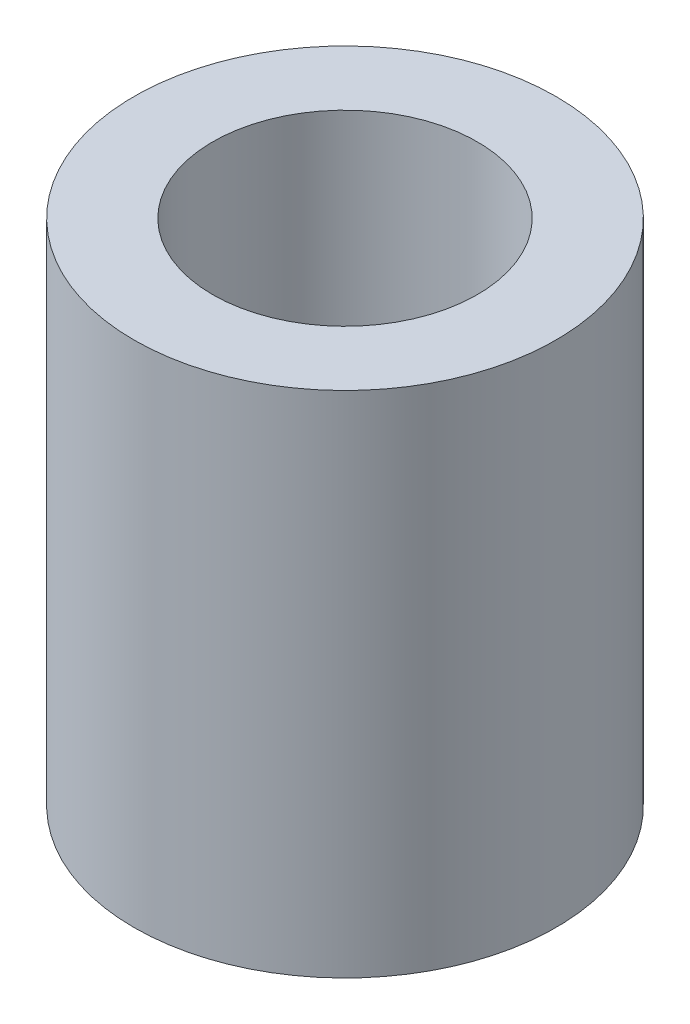
from build123d import *

# Parameters (mm, degrees)
SKETCH1_R           = 2.55
SKETCH1_R_2         = 1.6
BOSS_EXTRUDE1_DEPTH = 6.15


with BuildPart() as part:
    # Sketch1 → Boss-Extrude1 (new body)
    with BuildSketch(Plane(origin=(0, 0, 0), x_dir=(1, 0, 0), z_dir=(0, 1, 0))):
        Circle(SKETCH1_R)
        Circle(SKETCH1_R_2, mode=Mode.SUBTRACT)
    extrude(amount=BOSS_EXTRUDE1_DEPTH)


solid = part.part
